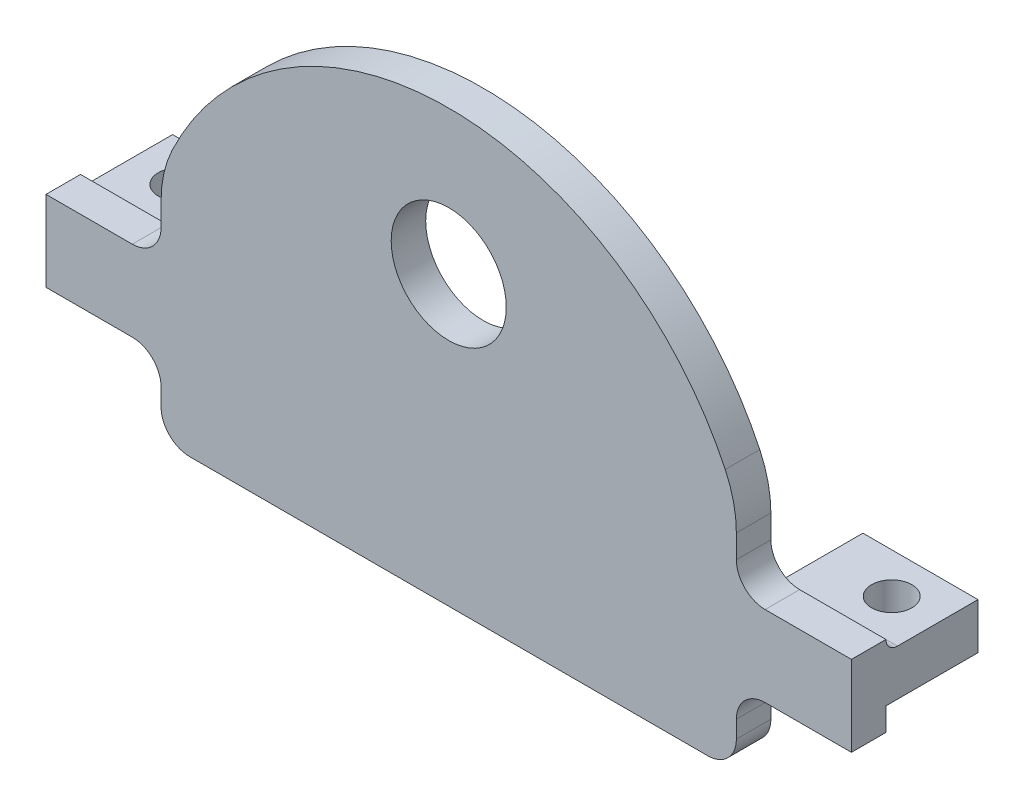
from build123d import *

# Parameters (mm, degrees)
SKETCH1_W           = 20
SKETCH1_H           = 155
BOSS_EXTRUDE1_DEPTH = 4
SKETCH2_W           = 20
SKETCH2_H           = 4
BOSS_EXTRUDE3_DEPTH = 50
RIB2_REACH          = 96.986
SKETCH7_WALL_W      = 290.205463948
SKETCH7_WALL_H      = 4
SKETCH8_W           = 20
SKETCH8_H           = 3
BOSS_EXTRUDE4_DEPTH = 3.5
SKETCH9_W           = 70
SKETCH9_H           = 5
BOSS_EXTRUDE6_DEPTH = 3
SKETCH10_W          = 10
SKETCH10_H          = 4
BOSS_EXTRUDE7_DEPTH = 8
SKETCH12_R          = 1.75
CUT_EXTRUDE1_DEPTH  = 10
SKETCH13_W          = 111.319070758
SKETCH13_H          = 99.743885808
CUT_EXTRUDE2_DEPTH  = 152
SKETCH14_W          = 50
SKETCH14_H          = 3
BOSS_EXTRUDE8_DEPTH = 6.5
FILLET1_R           = 1
FILLET2_R           = 2.5
SKETCH15_R          = 5
BOSS_EXTRUDE9_DEPTH = 3
FILLET3_R           = 10


with BuildPart() as part:
    # Sketch1 → Boss-Extrude1 (new body)
    with BuildSketch(Plane.XY):
        Rectangle(SKETCH1_W, SKETCH1_H)
    extrude(amount=BOSS_EXTRUDE1_DEPTH)

    # Sketch2 → Boss-Extrude3 (add)
    with BuildSketch(Plane.XY.offset(4)):
        with Locations((0, -75.5)):
            Rectangle(SKETCH2_W, SKETCH2_H)
    extrude(amount=BOSS_EXTRUDE3_DEPTH)

    # Sketch7 wall → Rib2 (add, up to next)
    with BuildSketch(Plane(origin=(0, -26, 16.5), x_dir=(0, 0.967074537263, -0.25449329928), z_dir=(0, 0.25449329928, 0.967074537263)), mode=Mode.PRIVATE) as rib2_sk1:
        Rectangle(SKETCH7_WALL_W, SKETCH7_WALL_H)
    rib2_tool1 = extrude(rib2_sk1.sketch, amount=-RIB2_REACH, mode=Mode.PRIVATE) - part.part
    add(rib2_tool1.solids().sort_by_distance((0, -26, 16.5))[0])

    # Sketch8 → Boss-Extrude4 (add)
    with BuildSketch(Plane.XY.offset(4)):
        with Locations((0, 76)):
            Rectangle(SKETCH8_W, SKETCH8_H)
    extrude(amount=BOSS_EXTRUDE4_DEPTH)

    # Sketch9 → Boss-Extrude6 (add)
    with BuildSketch(Plane.XY.offset(7.5)):
        with Locations((0, 77)):
            Rectangle(SKETCH9_W, SKETCH9_H)
    boss_extrude6 = extrude(amount=BOSS_EXTRUDE6_DEPTH)

    # Sketch10 → Boss-Extrude7 (add)
    with BuildSketch(Plane(origin=(0, 0, 7.5), x_dir=(-1, 0, 0), z_dir=(0, 0, -1))):
        with Locations((30, 76.5)):
            Rectangle(SKETCH10_W, SKETCH10_H)
        with Locations((-30, 76.5)):
            Rectangle(SKETCH10_W, SKETCH10_H)
    extrude(amount=BOSS_EXTRUDE7_DEPTH)

    # Sketch12 → Cut-Extrude1 (cut)
    with BuildSketch(Plane(origin=(0, 78.5, 0), x_dir=(1, 0, 0), z_dir=(0, 1, 0))):
        with Locations(Location((-31, -3, 0), (0, 0, 270))):
            Circle(SKETCH12_R)
        with Locations(Location((31, -3, 0), (0, 0, 270))):
            Circle(SKETCH12_R)
    extrude(amount=-CUT_EXTRUDE1_DEPTH, mode=Mode.SUBTRACT)

    # Sketch13 → Cut-Extrude2 (cut)
    with BuildSketch(Plane.XZ.offset(77.5)):
        with Locations((2.652852139, 20.474703111)):
            Rectangle(SKETCH13_W, SKETCH13_H)
    extrude(amount=-CUT_EXTRUDE2_DEPTH, mode=Mode.SUBTRACT)

    # Sketch14 → Boss-Extrude8 (add)
    with BuildSketch(Plane(origin=(0, 79.5, 0), x_dir=(1, 0, 0), z_dir=(0, 1, 0))):
        with Locations((0, -9)):
            Rectangle(SKETCH14_W, SKETCH14_H)
    boss_extrude8 = extrude(amount=BOSS_EXTRUDE8_DEPTH)

    # Mirror1: Boss-Extrude6, Boss-Extrude8 across plane
    add(boss_extrude6.mirror(Plane(origin=(0, 76, 0), x_dir=(0, 0, 1), z_dir=(0, -1, 0))))
    add(boss_extrude8.mirror(Plane(origin=(0, 76, 0), x_dir=(0, 0, 1), z_dir=(0, -1, 0))))

    # Fillet1
    fillet1_edges = [part.edges().sort_by_distance(p)[0] for p in [
        (30, 78.5, 7.5),
        (-30, 78.5, 7.5),
        (10, 76, 7.5),
        (-10, 76, 7.5),
        (0, 77.5, 7.5),
        (25, 76.5, 7.5),
        (-25, 76.5, 7.5),
    ]]
    fillet(fillet1_edges, radius=FILLET1_R - 0.0001)  # a hair under: the kernel refuses the full size

    # Fillet2
    fillet2_edges = [part.edges().sort_by_distance(p)[0] for p in [
        (-25, 79.5, 9),
        (25, 79.5, 9),
        (-25, 66, 9),
        (25, 66, 9),
        (-25, 72.5, 9),
        (25, 72.5, 9),
    ]]
    fillet(fillet2_edges, radius=FILLET2_R)

    # Sketch15 → Boss-Extrude9 (add)
    with BuildSketch(Plane(origin=(0, 0, 7.5), x_dir=(-1, 0, 0), z_dir=(0, 0, -1))):
        with BuildLine():
            Line((25, 86), (-25, 86))
            ThreePointArc((-25, 86), (0, 103.502), (25, 86))
        make_face()
        with Locations((0, 91.001)):
            Circle(SKETCH15_R, mode=Mode.SUBTRACT)
    extrude(amount=-BOSS_EXTRUDE9_DEPTH)

    # Fillet3
    fillet3_edges = [part.edges().sort_by_distance(p)[0] for p in [
        (-25, 86, 9),
        (25, 86, 9),
    ]]
    fillet(fillet3_edges, radius=FILLET3_R)


solid = part.part
